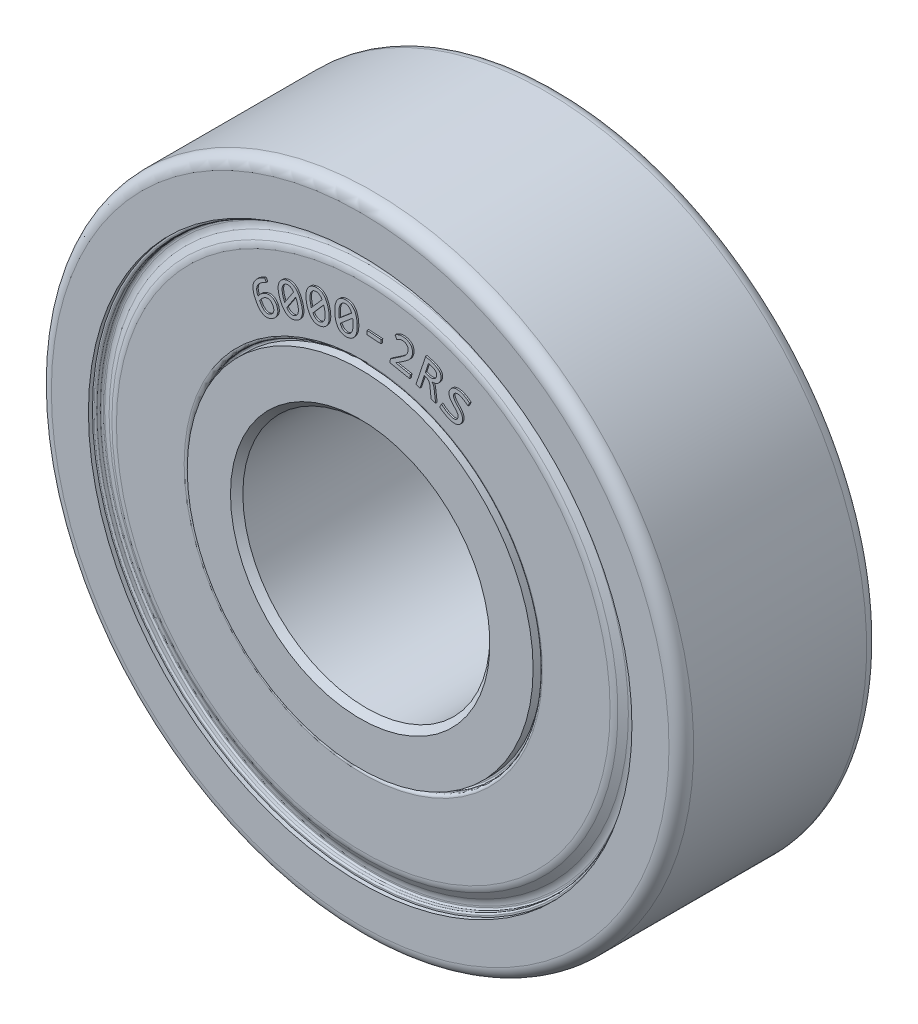
from build123d import *

# Parameters (mm, degrees)
EMBOSS_ON_SEAL_DEPTH = 0.0625


# Read off the part's stored shape, not the designer's step: Emboss_on_Seal
with BuildPart() as part:
    # Shield_RevolverSketch → ShieldsORseals (revolve)
    with BuildSketch(Plane(origin=(0, 0, 0), x_dir=(0, 0, -1), z_dir=(1, 0, 0)), mode=Mode.PRIVATE) as shieldsorseals_sk:
        with BuildLine():
            Line((-0.163675135, 11), (-7.836324865, 11))
            Line((-7.836324865, 11), (-7.836324865, 10.9375))
            ThreePointArc((-7.836324865, 10.9375), (-7.818019039, 10.893305826), (-7.773824865, 10.875))
            Line((-7.773824865, 10.875), (-7.648824865, 10.875))
            ThreePointArc((-7.648824865, 10.875), (-7.604630692, 10.856694174), (-7.586324865, 10.8125))
            Line((-7.586324865, 10.8125), (-7.586324865, 10.758974596))
            ThreePointArc((-7.586324865, 10.758974596), (-7.603361952, 10.629565074), (-7.653312164, 10.508974596))
            Line((-7.653312164, 10.508974596), (-7.808012702, 10.241025404))
            ThreePointArc((-7.808012702, 10.241025404), (-7.857962913, 10.120434926), (-7.875, 9.991025404))
            Line((-7.875, 9.991025404), (-7.875, 7.25))
            ThreePointArc((-7.875, 7.25), (-7.838388348, 7.161611652), (-7.75, 7.125))
            Line((-7.75, 7.125), (-7.6875, 7.125))
            ThreePointArc((-7.6875, 7.125), (-7.643305826, 7.106694174), (-7.625, 7.0625))
            Line((-7.625, 7.0625), (-7.625, 7))
            Line((-7.625, 7), (-0.375, 7))
            Line((-0.375, 7), (-0.375, 7.0625))
            ThreePointArc((-0.375, 7.0625), (-0.356694174, 7.106694174), (-0.3125, 7.125))
            Line((-0.3125, 7.125), (-0.25, 7.125))
            ThreePointArc((-0.25, 7.125), (-0.161611652, 7.161611652), (-0.125, 7.25))
            Line((-0.125, 7.25), (-0.125, 9.991025404))
            ThreePointArc((-0.125, 9.991025404), (-0.142037087, 10.120434926), (-0.191987298, 10.241025404))
            Line((-0.191987298, 10.241025404), (-0.346687836, 10.508974596))
            ThreePointArc((-0.346687836, 10.508974596), (-0.396638048, 10.629565074), (-0.413675135, 10.758974596))
            Line((-0.413675135, 10.758974596), (-0.413675135, 10.8125))
            ThreePointArc((-0.413675135, 10.8125), (-0.395369308, 10.856694174), (-0.351175135, 10.875))
            Line((-0.351175135, 10.875), (-0.226175135, 10.875))
            ThreePointArc((-0.226175135, 10.875), (-0.181980961, 10.893305826), (-0.163675135, 10.9375))
            Line((-0.163675135, 10.9375), (-0.163675135, 11))
        make_face()
    revolve(shieldsorseals_sk.sketch.rotate(Axis((0, 0, 0), (0, 0, 1)), 90), axis=Axis((0, 0, 0), (0, 0, 1)))

    # ProfileRevolveSketch → InnerANDouterRaces (revolve)
    with BuildSketch(Plane(origin=(0, 0, 0), x_dir=(0, 0, -1), z_dir=(1, 0, 0)), mode=Mode.PRIVATE) as innerandouterraces_sk:
        Polygon((0, 5.25), (0, 7), (-8, 7), (-8, 5.25), (-7.75, 5), (-0.25, 5), align=None)
        with BuildLine():
            Line((0, 12.5), (0, 11))
            Line((0, 11), (-8, 11))
            Line((-8, 11), (-8, 12.5))
            ThreePointArc((-8, 12.5), (-7.853553391, 12.853553391), (-7.5, 13))
            Line((-7.5, 13), (-0.5, 13))
            ThreePointArc((-0.5, 13), (-0.146446609, 12.853553391), (0, 12.5))
        make_face()
    revolve(innerandouterraces_sk.sketch.rotate(Axis((0, 0, 0), (0, 0, 1)), 90), axis=Axis((0, 0, 0), (0, 0, 1)))

    # Emboss_on_Seal outline → Emboss_on_Seal (add)
    # profile 1 of 8: a face of its own
    with BuildSketch(Plane.XY.offset(7.875)):
        with BuildLine():
            add(Edge.make_bspline(
                [(3.45441781, 7.031174743), (3.439631155, 7.038499205), (3.410117931, 7.053118366), (3.367389409, 7.077181496), (3.326412953, 7.102155225), (3.286919376, 7.126469494), (3.250409034, 7.151426575), (3.216410734, 7.175621691), (3.185657769, 7.199264957), (3.166590045, 7.215199518), (3.157486198, 7.222807442)],
                knots=[0, 0, 0, 0, 0.139730273, 0.278892739, 0.415112739, 0.546148088, 0.671591735, 0.789564422, 0.899527948, 1, 1, 1, 1], degree=3))
            add(Edge.make_bspline(
                [(4.053376144, 7.135624471), (4.046657939, 7.122921099), (4.033571714, 7.098176514), (4.009952171, 7.064432905), (3.983206117, 7.035289101), (3.953519284, 7.010867978), (3.921668075, 6.990592221), (3.887525726, 6.974704334), (3.851598479, 6.962414407), (3.81355886, 6.954589307), (3.773808663, 6.950547906), (3.732198561, 6.951137488), (3.68882432, 6.955041979), (3.64391045, 6.963141241), (3.597742222, 6.974732626), (3.550677175, 6.990275607), (3.502509524, 7.008824957), (3.470659743, 7.023626588), (3.45441781, 7.031174743)],
                knots=[0, 0, 0, 0, 0.06287168, 0.122466191, 0.179764453, 0.23551097, 0.290289466, 0.34461754, 0.400004764, 0.456149318, 0.51426959, 0.574581344, 0.638047313, 0.704738398, 0.774168554, 0.846277541, 0.921608574, 1, 1, 1, 1], degree=3))
            add(Edge.make_bspline(
                [(3.727572249, 7.959050649), (3.724292969, 7.951593225), (3.717892837, 7.937038655), (3.712829711, 7.914018129), (3.711560722, 7.891130414), (3.714673554, 7.868446791), (3.720815098, 7.845944347), (3.729346393, 7.823335984), (3.74024233, 7.800578015), (3.757973314, 7.769400779), (3.785930024, 7.730602271), (3.824988781, 7.684824444), (3.86808663, 7.638721584), (3.911561338, 7.590736221), (3.954732962, 7.541503565), (3.988901379, 7.498831536), (4.014491031, 7.463791109), (4.031443577, 7.436952363), (4.046322233, 7.409543107), (4.059050075, 7.381566261), (4.069621141, 7.353065058), (4.077402466, 7.323887996), (4.082070806, 7.294093755), (4.084506336, 7.263712823), (4.083609103, 7.232457971), (4.07749422, 7.200617442), (4.068119088, 7.167781176), (4.058386478, 7.146552807), (4.053376144, 7.135624471)],
                knots=[0, 0, 0, 0, 0.025721514, 0.050200386, 0.074112047, 0.097883538, 0.122285839, 0.147791641, 0.174230722, 0.202038248, 0.2611729, 0.325157145, 0.392347997, 0.460823694, 0.530019844, 0.599485921, 0.633702941, 0.667245272, 0.699837623, 0.732301208, 0.764411499, 0.795909548, 0.827662612, 0.859693708, 0.892254599, 0.92621805, 0.962017149, 1, 1, 1, 1], degree=3))
            add(Edge.make_bspline(
                [(4.060169622, 7.997263964), (4.049558478, 8.002282388), (4.029031008, 8.011990631), (3.998422668, 8.024250254), (3.969201897, 8.033682862), (3.941772643, 8.041761178), (3.915567024, 8.046418922), (3.890969618, 8.049201098), (3.867818603, 8.04916663), (3.846161102, 8.047008816), (3.826075986, 8.042418176), (3.807497846, 8.036142557), (3.790201827, 8.028303312), (3.774684028, 8.017922299), (3.760404833, 8.006082171), (3.747811964, 7.992232496), (3.736633436, 7.976572793), (3.730640177, 7.96498328), (3.727572249, 7.959050649)],
                knots=[0, 0, 0, 0, 0.093517572, 0.180911619, 0.262457481, 0.33815508, 0.408492174, 0.47424837, 0.53514468, 0.592597637, 0.647314469, 0.698905037, 0.748683471, 0.798102942, 0.847195376, 0.896149455, 0.946839267, 1, 1, 1, 1], degree=3))
            add(Edge.make_bspline(
                [(4.301621162, 7.832805178), (4.282400356, 7.849305069), (4.244270184, 7.882037501), (4.184043385, 7.92575903), (4.123190368, 7.965053564), (4.080928774, 7.986653798), (4.060169622, 7.997263964)],
                knots=[0, 0, 0, 0, 0.259263493, 0.51432609, 0.761434016, 1, 1, 1, 1], degree=3))
            Line((4.301621162, 7.832805178), (4.367857575, 7.970090051))
            add(Edge.make_bspline(
                [(4.127538281, 8.127472297), (4.137320454, 8.122684407), (4.157734081, 8.112692946), (4.187998581, 8.094857147), (4.219902029, 8.076565685), (4.250999369, 8.055450842), (4.282375821, 8.034703428), (4.312311784, 8.012811583), (4.341076545, 7.991735481), (4.359134891, 7.97714005), (4.367857575, 7.970090051)],
                knots=[0, 0, 0, 0, 0.113470904, 0.236793278, 0.36598711, 0.496639965, 0.628383824, 0.758026039, 0.883119846, 1, 1, 1, 1], degree=3))
            add(Edge.make_bspline(
                [(3.560282846, 8.020758076), (3.565139745, 8.030242597), (3.574848191, 8.049201191), (3.59377793, 8.075174402), (3.614669696, 8.100077541), (3.638688832, 8.122982256), (3.665679826, 8.143336963), (3.695038136, 8.161070006), (3.727334535, 8.17488964), (3.761883036, 8.185995214), (3.799153452, 8.193685261), (3.839114795, 8.197272123), (3.88154859, 8.196754775), (3.926556689, 8.19286849), (3.973965328, 8.184304036), (4.023529382, 8.17049726), (4.075358698, 8.15179474), (4.109730169, 8.135773184), (4.127538281, 8.127472297)],
                knots=[0, 0, 0, 0, 0.049384264, 0.098714132, 0.148731208, 0.200149232, 0.252350135, 0.305373005, 0.358908795, 0.414998657, 0.47357219, 0.535144948, 0.60083463, 0.670297316, 0.744600862, 0.824067626, 0.908848139, 1, 1, 1, 1], degree=3))
            add(Edge.make_bspline(
                [(3.88948348, 7.204408439), (3.892757014, 7.211867057), (3.899108877, 7.226339529), (3.904236162, 7.249151734), (3.905486901, 7.271857938), (3.902377477, 7.294444793), (3.896278412, 7.316867393), (3.887735337, 7.339336202), (3.876586013, 7.361708868), (3.858194645, 7.392209352), (3.830707004, 7.431069188), (3.790946799, 7.476161688), (3.748595036, 7.523002348), (3.704442412, 7.570575311), (3.661834866, 7.620351525), (3.62020582, 7.670380821), (3.583950745, 7.72267122), (3.560043569, 7.768637155), (3.545413966, 7.806207989), (3.537388527, 7.835028042), (3.532486091, 7.864445716), (3.529600438, 7.894453522), (3.530746798, 7.925307779), (3.536287406, 7.956857213), (3.5459172, 7.989109925), (3.555403217, 8.010008038), (3.560282846, 8.020758076)],
                knots=[0, 0, 0, 0, 0.025875241, 0.05020752, 0.073962163, 0.097875727, 0.122423871, 0.147801143, 0.174258853, 0.201864236, 0.261106971, 0.325438586, 0.39305102, 0.462137944, 0.531974653, 0.601575938, 0.669211711, 0.734084274, 0.76592956, 0.79740454, 0.8291008, 0.860748653, 0.893204044, 0.92702293, 0.962460426, 1, 1, 1, 1], degree=3))
            add(Edge.make_bspline(
                [(3.530844441, 7.160533891), (3.542770199, 7.154930348), (3.565735647, 7.144139598), (3.599748029, 7.130689526), (3.631479062, 7.119413495), (3.661344354, 7.11106482), (3.689382968, 7.105638368), (3.715701643, 7.10280839), (3.740268584, 7.101927032), (3.763237895, 7.104346576), (3.784523534, 7.108794317), (3.804338807, 7.115510208), (3.822190059, 7.125039171), (3.838730882, 7.136438845), (3.853351232, 7.150576469), (3.867001686, 7.166424196), (3.879361921, 7.184411277), (3.886049159, 7.19762325), (3.88948348, 7.204408439)],
                knots=[0, 0, 0, 0, 0.096309947, 0.185464196, 0.267273306, 0.342415518, 0.41195339, 0.475790047, 0.535819693, 0.591280026, 0.644180236, 0.694574418, 0.743633703, 0.791668714, 0.840955407, 0.89183355, 0.944449651, 1, 1, 1, 1], degree=3))
            add(Edge.make_bspline(
                [(3.22881772, 7.370282533), (3.237971487, 7.361033592), (3.256668415, 7.342142269), (3.28710094, 7.315046796), (3.319992991, 7.288174843), (3.355466174, 7.26131791), (3.394357656, 7.235323723), (3.436683252, 7.209921968), (3.482321195, 7.184591034), (3.514359317, 7.168706983), (3.530844441, 7.160533891)],
                knots=[0, 0, 0, 0, 0.10557827, 0.215647752, 0.330451754, 0.450204732, 0.576561049, 0.70984495, 0.850701559, 1, 1, 1, 1], degree=3))
            Line((3.22881772, 7.370282533), (3.157486198, 7.222807442))
        make_face()
    # profile 2 of 8: a face of its own
    with BuildSketch(Plane.XY.offset(7.875)):
        with BuildLine():
            add(Edge.make_bspline(
                [(2.759169747, 7.771932374), (2.757240802, 7.787371428), (2.753645028, 7.816151591), (2.743668991, 7.8557549), (2.730921652, 7.889416334), (2.713687453, 7.917321634), (2.693197432, 7.940786911), (2.668117423, 7.959437553), (2.639432742, 7.975246351), (2.618236627, 7.983006157), (2.607165671, 7.987059186)],
                knots=[0, 0, 0, 0, 0.164940583, 0.307468114, 0.432394679, 0.545200928, 0.653695775, 0.760819421, 0.875073435, 1, 1, 1, 1], degree=3))
            Line((2.759169747, 7.771932374), (2.809554711, 7.336300581))
            Line((2.809554711, 7.336300581), (2.990997193, 7.276008461))
            Line((2.990997193, 7.276008461), (2.933252627, 7.726359458))
            add(Edge.make_bspline(
                [(2.836162501, 7.951959548), (2.84314297, 7.946114543), (2.85706355, 7.934458327), (2.874712985, 7.913371196), (2.889593165, 7.88979661), (2.901015482, 7.863142053), (2.910984403, 7.833862471), (2.919655894, 7.801214843), (2.92727167, 7.765021728), (2.931205788, 7.739590696), (2.933252627, 7.726359458)],
                knots=[0, 0, 0, 0, 0.108189091, 0.215752654, 0.32575114, 0.438870128, 0.559980313, 0.69374438, 0.840661551, 1, 1, 1, 1], degree=3))
            add(Edge.make_bspline(
                [(3.19112174, 8.174729023), (3.187866384, 8.16570802), (3.18142856, 8.147867995), (3.169397971, 8.122360427), (3.155867471, 8.098104323), (3.14023101, 8.075616894), (3.123351598, 8.054465805), (3.104365238, 8.035455456), (3.084102153, 8.017805542), (3.061950457, 8.002240963), (3.038334093, 7.988783574), (3.013580002, 7.9764808), (2.98692107, 7.967257017), (2.959135485, 7.959079876), (2.9300456, 7.953486952), (2.899743554, 7.950362808), (2.868307154, 7.949825954), (2.847007296, 7.951239727), (2.836162501, 7.951959548)],
                knots=[0, 0, 0, 0, 0.063202166, 0.124989237, 0.185718043, 0.24611454, 0.305382274, 0.363890912, 0.423001714, 0.482377098, 0.542025622, 0.602126624, 0.664313292, 0.727720268, 0.792994987, 0.859293363, 0.9283594, 1, 1, 1, 1], degree=3))
            add(Edge.make_bspline(
                [(2.904663406, 8.61460674), (2.921172295, 8.608899176), (2.952980316, 8.597902293), (2.997639703, 8.578128564), (3.03796145, 8.557187824), (3.073484656, 8.534063934), (3.104823766, 8.509932568), (3.132325598, 8.484807756), (3.155262662, 8.458031986), (3.174529085, 8.430436778), (3.189708005, 8.401638988), (3.200761872, 8.371632314), (3.208300336, 8.340578789), (3.211461085, 8.308511006), (3.211532205, 8.275783614), (3.207888121, 8.242462896), (3.201622199, 8.208459883), (3.194657221, 8.18608613), (3.19112174, 8.174729023)],
                knots=[0, 0, 0, 0, 0.087682314, 0.168939342, 0.245029882, 0.315605213, 0.381473015, 0.443500021, 0.502293813, 0.558152352, 0.612196922, 0.665268996, 0.718364331, 0.772207052, 0.826696356, 0.882424118, 0.940317481, 1, 1, 1, 1], degree=3))
            Line((2.904663406, 8.61460674), (2.588766667, 8.719905653))
            Line((2.588766667, 8.719905653), (2.196160236, 7.540671052))
            Line((2.196160236, 7.540671052), (2.35665616, 7.487172411))
            Line((2.35665616, 7.487172411), (2.531305164, 8.012251668))
            Line((2.531305164, 8.012251668), (2.607165671, 7.987059186))
        make_face()
        with BuildLine():
            add(Edge.make_bspline(
                [(2.704255798, 8.098019331), (2.713556816, 8.095045414), (2.731713153, 8.089240089), (2.758919226, 8.083149371), (2.785183184, 8.078775835), (2.810540462, 8.076433842), (2.835084791, 8.076386233), (2.858398262, 8.07863363), (2.880603481, 8.082897205), (2.90156843, 8.089287423), (2.92112142, 8.098321047), (2.93978833, 8.108623166), (2.95675551, 8.121656441), (2.972825833, 8.136251227), (2.986850495, 8.153521135), (2.999873084, 8.172391243), (3.010180097, 8.193947466), (3.015836602, 8.209123174), (3.018737229, 8.216905201)],
                knots=[0, 0, 0, 0, 0.077017221, 0.150343817, 0.219743991, 0.287014878, 0.351043494, 0.413124933, 0.471530521, 0.529224723, 0.585543029, 0.641227858, 0.697066767, 0.753962813, 0.812111589, 0.87220122, 0.934465428, 1, 1, 1, 1], degree=3))
            Line((2.704255798, 8.098019331), (2.574330526, 8.141327755))
            Line((2.574330526, 8.141327755), (2.703972736, 8.53110357))
            Line((2.703972736, 8.53110357), (2.855693751, 8.480718606))
            add(Edge.make_bspline(
                [(3.018737229, 8.216905201), (3.021166838, 8.224598928), (3.025883062, 8.239533566), (3.030044172, 8.262055381), (3.032101445, 8.283562989), (3.031939752, 8.304281788), (3.029088641, 8.324059526), (3.023883412, 8.343044854), (3.016593773, 8.361165941), (3.006803059, 8.378333627), (2.994809334, 8.394471601), (2.980850125, 8.409806793), (2.96497891, 8.424274384), (2.947044416, 8.437616679), (2.926933628, 8.449784669), (2.905046642, 8.461313733), (2.881144587, 8.471896952), (2.864326323, 8.477726423), (2.855693751, 8.480718606)],
                knots=[0, 0, 0, 0, 0.068446959, 0.132865454, 0.194007603, 0.251693162, 0.308340268, 0.363144697, 0.41848518, 0.473732809, 0.530453509, 0.588868735, 0.649547279, 0.712514812, 0.778327926, 0.848921222, 0.922453443, 1, 1, 1, 1], degree=3))
        make_face(mode=Mode.SUBTRACT)
    # profile 3 of 8: a face of its own
    with BuildSketch(Plane.XY.offset(7.875)):
        with BuildLine():
            add(Edge.make_bspline(
                [(1.540922421, 8.170595752), (1.555779835, 8.180438271), (1.58425403, 8.199301434), (1.624371568, 8.227357523), (1.660486279, 8.253410185), (1.692612134, 8.277809772), (1.721323554, 8.300909548), (1.746728147, 8.323293918), (1.76954668, 8.344675201), (1.789249181, 8.365813468), (1.806236117, 8.386445735), (1.820910431, 8.406706213), (1.833107787, 8.426787815), (1.846492521, 8.453689075), (1.859765508, 8.489292127), (1.866420388, 8.519042629), (1.869839993, 8.534329901)],
                knots=[0, 0, 0, 0, 0.105706182, 0.202585624, 0.290352419, 0.369826149, 0.441848578, 0.508870087, 0.570625752, 0.627251094, 0.680135288, 0.729059969, 0.775515144, 0.819315489, 0.907155413, 1, 1, 1, 1], degree=3))
            Line((1.540922421, 8.170595752), (1.161902946, 7.917538687))
            Line((1.161902946, 7.917538687), (1.133313725, 7.771195843))
            Line((1.133313725, 7.771195843), (1.940605392, 7.612964411))
            Line((1.940605392, 7.612964411), (1.971176044, 7.768648288))
            Line((1.971176044, 7.768648288), (1.375897511, 7.885552727))
            Line((1.375897511, 7.885552727), (1.640560102, 8.058503361))
            add(Edge.make_bspline(
                [(2.048451859, 8.51111885), (2.045963558, 8.499664694), (2.041066882, 8.477124296), (2.031207887, 8.44450321), (2.018854275, 8.413744837), (2.004656123, 8.384375935), (1.988171971, 8.356109546), (1.968809803, 8.328910746), (1.94786133, 8.301639772), (1.923772623, 8.275389315), (1.897632212, 8.249207151), (1.868873704, 8.223091151), (1.837530441, 8.196954349), (1.803703356, 8.170432448), (1.766878501, 8.143941835), (1.727606065, 8.116046181), (1.685070353, 8.087598507), (1.655674387, 8.06838316), (1.640560102, 8.058503361)],
                knots=[0, 0, 0, 0, 0.055981022, 0.110163911, 0.162560634, 0.214168157, 0.265885793, 0.318653443, 0.373564502, 0.430051332, 0.488696342, 0.550276703, 0.615548783, 0.683624289, 0.75556958, 0.832228893, 0.913738491, 1, 1, 1, 1], degree=3))
            add(Edge.make_bspline(
                [(1.75208637, 8.940240227), (1.765361814, 8.937374064), (1.791362626, 8.931760498), (1.828570658, 8.919287353), (1.863583607, 8.904776314), (1.895851083, 8.887055624), (1.925709287, 8.867316123), (1.952761236, 8.845136364), (1.976948818, 8.820662696), (1.99835372, 8.79399544), (2.016356301, 8.765012035), (2.031746629, 8.734149635), (2.043081158, 8.70095435), (2.051657333, 8.666021044), (2.056853321, 8.629419142), (2.0577673, 8.591194324), (2.055334881, 8.551474206), (2.050779908, 8.524768266), (2.048451859, 8.51111885)],
                knots=[0, 0, 0, 0, 0.069223284, 0.135578262, 0.199846242, 0.262299269, 0.323031911, 0.382188116, 0.440381148, 0.498254897, 0.556206633, 0.614104389, 0.673769353, 0.734699982, 0.797384369, 0.861902333, 0.929418228, 1, 1, 1, 1], degree=3))
            add(Edge.make_bspline(
                [(1.350138906, 8.851358886), (1.364220239, 8.860875078), (1.392368122, 8.879897473), (1.437377229, 8.903480437), (1.484305499, 8.922888103), (1.533057701, 8.938344116), (1.584337891, 8.948932913), (1.638255889, 8.952146847), (1.69468928, 8.950231134), (1.732608234, 8.943630717), (1.75208637, 8.940240227)],
                knots=[0, 0, 0, 0, 0.120158552, 0.240190966, 0.358697358, 0.479031913, 0.601560619, 0.728015444, 0.860287488, 1, 1, 1, 1], degree=3))
            Line((1.350138906, 8.851358886), (1.418922874, 8.7259626))
            add(Edge.make_bspline(
                [(1.70226753, 8.800124737), (1.689466759, 8.802142031), (1.66425441, 8.806115285), (1.626394294, 8.806502569), (1.589367673, 8.802677221), (1.553472542, 8.793649629), (1.518589648, 8.780978688), (1.484383388, 8.765641323), (1.451033979, 8.747253155), (1.429679891, 8.733094801), (1.418922874, 8.7259626)],
                knots=[0, 0, 0, 0, 0.128888135, 0.253857587, 0.375766508, 0.498587941, 0.621319507, 0.744950374, 0.871519995, 1, 1, 1, 1], degree=3))
            add(Edge.make_bspline(
                [(1.869839993, 8.534329901), (1.872173191, 8.549099906), (1.876777086, 8.578244274), (1.876022623, 8.615094878), (1.871845798, 8.6434696), (1.867161883, 8.663914985), (1.860251777, 8.683341444), (1.851517664, 8.701802774), (1.840637486, 8.719130805), (1.827927932, 8.735563276), (1.812364992, 8.750112517), (1.795161878, 8.763913331), (1.775409223, 8.775748387), (1.753392155, 8.786124246), (1.728710377, 8.794173478), (1.71126714, 8.798099274), (1.70226753, 8.800124737)],
                knots=[0, 0, 0, 0, 0.125758755, 0.248148814, 0.308380614, 0.367164157, 0.424462848, 0.481684355, 0.538789889, 0.596494843, 0.656062592, 0.717739353, 0.781924315, 0.849464456, 0.922333157, 1, 1, 1, 1], degree=3))
        make_face()
    # profile 4 of 8: a face of its own
    with BuildSketch(Plane.XY.offset(7.875)):
        with BuildLine():
            add(Edge.make_bspline(
                [(-0.604750759, 7.796404539), (-0.621169788, 7.79577765), (-0.653306222, 7.794550661), (-0.700812561, 7.798580321), (-0.746194262, 7.807803242), (-0.789840332, 7.821099847), (-0.830847458, 7.840364047), (-0.869462474, 7.864569135), (-0.905213463, 7.894359551), (-0.938655737, 7.929132453), (-0.968921322, 7.969601539), (-0.996133209, 8.015611616), (-1.02045218, 8.067065441), (-1.041629942, 8.124169037), (-1.059368445, 8.187036647), (-1.073695682, 8.255693519), (-1.084463668, 8.330195497), (-1.088433314, 8.381933454), (-1.090484454, 8.408666767)],
                knots=[0, 0, 0, 0, 0.055741177, 0.109100398, 0.161363959, 0.212725579, 0.263597476, 0.31469575, 0.367026011, 0.421168755, 0.478118948, 0.538159501, 0.602345894, 0.671062857, 0.744670079, 0.823886247, 0.909000967, 1, 1, 1, 1], degree=3))
            add(Edge.make_bspline(
                [(-0.182988983, 8.467543578), (-0.181756567, 8.444150681), (-0.179347188, 8.398417445), (-0.180675555, 8.331019912), (-0.185351515, 8.266554534), (-0.193701705, 8.205042808), (-0.20600642, 8.1470795), (-0.222375922, 8.09281757), (-0.243132579, 8.042668769), (-0.267363035, 7.996212799), (-0.295764684, 7.954159656), (-0.327906475, 7.916392689), (-0.364158465, 7.883332715), (-0.404257574, 7.854817511), (-0.448426147, 7.831362211), (-0.496861215, 7.81390629), (-0.549286475, 7.801441365), (-0.585906231, 7.798115849), (-0.604750759, 7.796404539)],
                knots=[0, 0, 0, 0, 0.078571948, 0.153608567, 0.225985767, 0.295333763, 0.361707588, 0.424594984, 0.485205426, 0.543547098, 0.600090982, 0.655097759, 0.70954788, 0.764269712, 0.81978065, 0.876766768, 0.936584175, 1, 1, 1, 1], degree=3))
            add(Edge.make_bspline(
                [(-0.668439617, 9.080654992), (-0.652019357, 9.081285217), (-0.619880515, 9.082518736), (-0.572391533, 9.07844202), (-0.526918126, 9.069386178), (-0.483434298, 9.055432087), (-0.44193633, 9.036925581), (-0.403575585, 9.012097915), (-0.367472639, 8.982454158), (-0.334458675, 8.947066575), (-0.303877098, 8.906594151), (-0.276831278, 8.860413654), (-0.252727038, 8.80885397), (-0.231906895, 8.751700364), (-0.214124717, 8.688984009), (-0.199746664, 8.620428149), (-0.189014751, 8.546014078), (-0.185041821, 8.494276629), (-0.182988983, 8.467543578)],
                knots=[0, 0, 0, 0, 0.055707574, 0.109034629, 0.161266683, 0.21269407, 0.263692267, 0.314931013, 0.367229728, 0.421803707, 0.478719568, 0.538999093, 0.603010068, 0.671574354, 0.745137203, 0.823992414, 0.909055824, 1, 1, 1, 1], degree=3))
            add(Edge.make_bspline(
                [(-1.090484454, 8.408666767), (-1.091586445, 8.432060006), (-1.093745444, 8.477891608), (-1.09264109, 8.545298886), (-1.0874901, 8.609847022), (-1.078964043, 8.671468376), (-1.066221335, 8.729739296), (-1.050041586, 8.784317312), (-1.029475222, 8.834649119), (-1.005589331, 8.881208803), (-0.977099169, 8.92314351), (-0.945100173, 8.961067939), (-0.908369491, 8.993607909), (-0.868400866, 9.022292625), (-0.824056243, 9.045666201), (-0.77574538, 9.063504645), (-0.723384346, 9.075489773), (-0.68708609, 9.078902083), (-0.668439617, 9.080654992)],
                knots=[0, 0, 0, 0, 0.078520134, 0.153835197, 0.225884619, 0.295554851, 0.362271338, 0.425732465, 0.486192349, 0.544357567, 0.600872879, 0.65585186, 0.710296538, 0.764990718, 0.820473606, 0.877837259, 0.937244803, 1, 1, 1, 1], degree=3))
        make_face()
        with BuildLine():
            add(Edge.make_bspline(
                [(-0.869413349, 8.150514593), (-0.863200611, 8.134814808), (-0.851035421, 8.104072988), (-0.828232502, 8.061316663), (-0.801667387, 8.023429509), (-0.770684001, 7.991482759), (-0.735197629, 7.966643399), (-0.702611454, 7.951647893), (-0.674758886, 7.943641521), (-0.652326729, 7.940164422), (-0.628740087, 7.938280493), (-0.612678203, 7.938988649), (-0.604467697, 7.939350644)],
                knots=[0, 0, 0, 0, 0.138000298, 0.270218995, 0.39525855, 0.515298467, 0.632179512, 0.74750934, 0.806863456, 0.868640777, 0.932851853, 1, 1, 1, 1], degree=3))
            Line((-0.869413349, 8.150514593), (-0.366412896, 8.577371477))
            add(Edge.make_bspline(
                [(-0.350561447, 8.450842944), (-0.351404949, 8.461609869), (-0.353087724, 8.483089732), (-0.357389024, 8.515012323), (-0.361361305, 8.546485367), (-0.364747667, 8.567190038), (-0.366412896, 8.577371477)],
                knots=[0, 0, 0, 0, 0.253949756, 0.506626183, 0.757385403, 1, 1, 1, 1], degree=3))
            add(Edge.make_bspline(
                [(-0.604467697, 7.939350644), (-0.593850488, 7.940370141), (-0.572920449, 7.942379908), (-0.542767334, 7.950564555), (-0.514344051, 7.962221128), (-0.487788048, 7.977899413), (-0.463494294, 7.997711149), (-0.440749614, 8.020664173), (-0.421145725, 8.047983676), (-0.403150598, 8.078403179), (-0.387538421, 8.112628212), (-0.374741177, 8.150521157), (-0.36426149, 8.191990863), (-0.356160618, 8.236911154), (-0.350468528, 8.285496613), (-0.347893208, 8.337581652), (-0.347450332, 8.393132309), (-0.349503762, 8.43122308), (-0.350561447, 8.450842944)],
                knots=[0, 0, 0, 0, 0.050190388, 0.098941899, 0.146589892, 0.194634614, 0.243663164, 0.293975531, 0.346448235, 0.401662317, 0.460360173, 0.523358812, 0.589901704, 0.661770283, 0.738326817, 0.820266467, 0.907422522, 1, 1, 1, 1], degree=3))
        make_face(mode=Mode.SUBTRACT)
        with BuildLine():
            add(Edge.make_bspline(
                [(-0.408306012, 8.733904539), (-0.414354016, 8.749267638), (-0.42611943, 8.779154068), (-0.449445285, 8.820018583), (-0.475429149, 8.856594697), (-0.506364576, 8.886804745), (-0.541020108, 8.911301947), (-0.573449823, 8.925283357), (-0.600790347, 8.933364537), (-0.622649598, 8.936923322), (-0.645488377, 8.938770767), (-0.661078505, 8.938066825), (-0.669005741, 8.937708886)],
                knots=[0, 0, 0, 0, 0.138379714, 0.2691954, 0.3938291, 0.513646558, 0.630274392, 0.747969712, 0.808113429, 0.869162392, 0.933471962, 1, 1, 1, 1], degree=3))
            Line((-0.408306012, 8.733904539), (-0.911023404, 8.309029086))
            add(Edge.make_bspline(
                [(-0.922628929, 8.425367401), (-0.921978073, 8.415553881), (-0.920669687, 8.395826195), (-0.918540195, 8.366359162), (-0.915591627, 8.337337252), (-0.912528826, 8.31835782), (-0.911023404, 8.309029086)],
                knots=[0, 0, 0, 0, 0.252229846, 0.507046496, 0.757704438, 1, 1, 1, 1], degree=3))
            add(Edge.make_bspline(
                [(-0.669005741, 8.937708886), (-0.679524853, 8.936675311), (-0.700352127, 8.934628889), (-0.730489865, 8.926568448), (-0.758797857, 8.91450727), (-0.785283168, 8.898843052), (-0.809908715, 8.879475672), (-0.832002072, 8.855898669), (-0.852181097, 8.828873243), (-0.870066, 8.798121869), (-0.885194673, 8.763658067), (-0.898225495, 8.725784762), (-0.908963632, 8.68434457), (-0.917013485, 8.639295675), (-0.922726663, 8.590714772), (-0.925295757, 8.538628388), (-0.925740433, 8.483078121), (-0.923686746, 8.444987294), (-0.922628929, 8.425367401)],
                knots=[0, 0, 0, 0, 0.049726452, 0.098455685, 0.146253734, 0.194276502, 0.243005736, 0.293306896, 0.346020493, 0.401592811, 0.460485651, 0.523035285, 0.590089097, 0.661924836, 0.738446388, 0.820348596, 0.907464825, 1, 1, 1, 1], degree=3))
        make_face(mode=Mode.SUBTRACT)
    # profile 5 of 8: a face of its own
    with BuildSketch(Plane.XY.offset(7.875)):
        with BuildLine():
            add(Edge.make_bspline(
                [(-1.660323182, 7.647717326), (-1.676506381, 7.644762029), (-1.708231794, 7.638968489), (-1.755984862, 7.635740199), (-1.802465119, 7.638181528), (-1.84780483, 7.644937128), (-1.891399085, 7.657949904), (-1.933357358, 7.676065428), (-1.973255617, 7.700257767), (-2.011454614, 7.729777917), (-2.047094263, 7.765639468), (-2.081068216, 7.806906538), (-2.112277103, 7.854576541), (-2.141847823, 7.907921639), (-2.168682404, 7.967706993), (-2.19274745, 8.033717284), (-2.214806667, 8.105844884), (-2.226392002, 8.156483861), (-2.232390663, 8.182703739)],
                knots=[0, 0, 0, 0, 0.055690295, 0.1091748, 0.161647253, 0.213083776, 0.264049566, 0.315286157, 0.367461933, 0.421669068, 0.478388725, 0.538334195, 0.60241655, 0.671076633, 0.744734798, 0.824105681, 0.908925338, 1, 1, 1, 1], degree=3))
            add(Edge.make_bspline(
                [(-1.341878888, 8.375185623), (-1.337140136, 8.352215748), (-1.327862073, 8.307242741), (-1.319364931, 8.240248057), (-1.314298588, 8.175627312), (-1.313696649, 8.113487139), (-1.317225428, 8.054145105), (-1.325221959, 7.997903647), (-1.338382085, 7.945078602), (-1.355501291, 7.895558466), (-1.377312464, 7.849713414), (-1.403867229, 7.807743572), (-1.434865585, 7.769564665), (-1.47040621, 7.73539418), (-1.51070962, 7.705553555), (-1.556148682, 7.681037402), (-1.606244998, 7.660864073), (-1.641976698, 7.652177472), (-1.660323182, 7.647717326)],
                knots=[0, 0, 0, 0, 0.078514714, 0.153724949, 0.2259668, 0.295483762, 0.361649773, 0.424879937, 0.485421576, 0.543681573, 0.600071934, 0.655034913, 0.709614184, 0.764365135, 0.819725395, 0.876994164, 0.936842511, 1, 1, 1, 1], degree=3))
            add(Edge.make_bspline(
                [(-1.91394637, 8.911021221), (-1.89776697, 8.914098342), (-1.866063568, 8.920127934), (-1.818380733, 8.923235515), (-1.771961605, 8.92093765), (-1.726695581, 8.913662389), (-1.682949821, 8.900862367), (-1.640842645, 8.882692487), (-1.600989285, 8.858195088), (-1.562902576, 8.828288197), (-1.526783085, 8.792631171), (-1.492941494, 8.750944867), (-1.46178139, 8.703081905), (-1.432117451, 8.649693428), (-1.405393074, 8.589961719), (-1.381097487, 8.524153363), (-1.359563636, 8.451984989), (-1.347914003, 8.401394255), (-1.341878888, 8.375185623)],
                knots=[0, 0, 0, 0, 0.055697912, 0.1091396, 0.161251111, 0.212697022, 0.263928434, 0.315124009, 0.367423021, 0.421783128, 0.478684513, 0.538829171, 0.603126402, 0.671731521, 0.74533072, 0.824338577, 0.908998246, 1, 1, 1, 1], degree=3))
            add(Edge.make_bspline(
                [(-2.232390663, 8.182703739), (-2.237015884, 8.20567791), (-2.246093472, 8.250767664), (-2.254592406, 8.317829853), (-2.259776094, 8.38254373), (-2.259977589, 8.444788166), (-2.256243537, 8.504329717), (-2.247799802, 8.560681134), (-2.23506009, 8.613645673), (-2.218199639, 8.663306029), (-2.19640257, 8.709152916), (-2.170159697, 8.751365148), (-2.139092874, 8.789431778), (-2.103565641, 8.823733441), (-2.063014144, 8.853362044), (-2.017697045, 8.877999693), (-1.967680581, 8.897801768), (-1.932188077, 8.906533477), (-1.91394637, 8.911021221)],
                knots=[0, 0, 0, 0, 0.0784223, 0.153913809, 0.226125033, 0.295610369, 0.362083823, 0.425646015, 0.486086939, 0.544218509, 0.600870056, 0.655641522, 0.710197654, 0.764925392, 0.820516676, 0.877761164, 0.937174198, 1, 1, 1, 1], degree=3))
        make_face()
        with BuildLine():
            add(Edge.make_bspline(
                [(-1.975087674, 7.959651203), (-1.966699115, 7.944938374), (-1.950323532, 7.916216978), (-1.921413653, 7.87715459), (-1.889277902, 7.843824678), (-1.853815491, 7.81691197), (-1.815093355, 7.797382846), (-1.780489458, 7.787258423), (-1.751559758, 7.783354746), (-1.728798552, 7.783365016), (-1.705158728, 7.784793952), (-1.689358807, 7.787927107), (-1.68126974, 7.789531185)],
                knots=[0, 0, 0, 0, 0.138114821, 0.269618472, 0.395389575, 0.514727632, 0.631108304, 0.747336073, 0.807117999, 0.868716647, 0.932787005, 1, 1, 1, 1], degree=3))
            Line((-1.975087674, 7.959651203), (-1.540022004, 8.457273486))
            add(Edge.make_bspline(
                [(-1.50548849, 8.333858631), (-1.507962812, 8.34444486), (-1.51288588, 8.365507883), (-1.521549459, 8.396679044), (-1.530455472, 8.427271916), (-1.536866952, 8.447378939), (-1.540022004, 8.457273486)],
                knots=[0, 0, 0, 0, 0.254385274, 0.506140848, 0.756974859, 1, 1, 1, 1], degree=3))
            add(Edge.make_bspline(
                [(-1.68126974, 7.789531185), (-1.671000077, 7.792204347), (-1.65069734, 7.797489088), (-1.621933807, 7.809720196), (-1.595638743, 7.825792436), (-1.571721018, 7.84526013), (-1.54988484, 7.867881947), (-1.531760541, 7.894594767), (-1.515532571, 7.924018588), (-1.502743967, 7.957009428), (-1.492519682, 7.99321297), (-1.485325062, 8.032642442), (-1.480755295, 8.075310367), (-1.479609975, 8.121186007), (-1.480883468, 8.17016405), (-1.486001772, 8.222108241), (-1.493779175, 8.277131707), (-1.501503628, 8.314553578), (-1.50548849, 8.333858631)],
                knots=[0, 0, 0, 0, 0.049897755, 0.098645983, 0.146475314, 0.194469291, 0.243471722, 0.293859136, 0.345923154, 0.401339452, 0.459960247, 0.522758525, 0.589749034, 0.66172493, 0.738583575, 0.820200885, 0.907245918, 1, 1, 1, 1], degree=3))
        make_face(mode=Mode.SUBTRACT)
        with BuildLine():
            add(Edge.make_bspline(
                [(-1.604276986, 8.606163884), (-1.612656766, 8.620420782), (-1.628952168, 8.648144884), (-1.65778557, 8.685417794), (-1.689056689, 8.717724448), (-1.724223136, 8.743157316), (-1.762356977, 8.761946711), (-1.796396405, 8.771440049), (-1.824685596, 8.775278159), (-1.846902068, 8.775868441), (-1.869829844, 8.773768606), (-1.885187684, 8.770932882), (-1.892999812, 8.769490424)],
                knots=[0, 0, 0, 0, 0.138351043, 0.26903879, 0.393620758, 0.513569699, 0.630525504, 0.747841005, 0.807620012, 0.869265072, 0.933498586, 1, 1, 1, 1], degree=3))
            Line((-1.604276986, 8.606163884), (-2.040191841, 8.110523033))
            add(Edge.make_bspline(
                [(-2.068498, 8.224030732), (-2.066315716, 8.21431516), (-2.061971322, 8.19497384), (-2.055705808, 8.166069578), (-2.048357123, 8.137954215), (-2.042883769, 8.119566536), (-2.040191841, 8.110523033)],
                knots=[0, 0, 0, 0, 0.255275749, 0.508191355, 0.758116662, 1, 1, 1, 1], degree=3))
            add(Edge.make_bspline(
                [(-1.892999812, 8.769490424), (-1.903275652, 8.766934191), (-1.923614942, 8.761874559), (-1.952333112, 8.749568296), (-1.978736629, 8.733440679), (-2.002733671, 8.713935463), (-2.024362384, 8.691034723), (-2.042603514, 8.664389762), (-2.058717822, 8.634699836), (-2.071540365, 8.601445765), (-2.0816769, 8.565039325), (-2.089098566, 8.525460193), (-2.092981344, 8.482644194), (-2.094909004, 8.436802188), (-2.092923305, 8.387825724), (-2.088052719, 8.335873024), (-2.080192191, 8.280757978), (-2.072477715, 8.243335894), (-2.068498, 8.224030732)],
                knots=[0, 0, 0, 0, 0.049684951, 0.09834297, 0.146083792, 0.194612423, 0.243219941, 0.293514112, 0.34587164, 0.401597676, 0.460536577, 0.523218646, 0.590480704, 0.662338449, 0.738625957, 0.820533605, 0.90741756, 1, 1, 1, 1], degree=3))
        make_face(mode=Mode.SUBTRACT)
    # profile 6 of 8: a face of its own
    with BuildSketch(Plane.XY.offset(7.875)):
        with BuildLine():
            add(Edge.make_bspline(
                [(-2.683269103, 7.352005497), (-2.698739172, 7.346832673), (-2.729001055, 7.33671382), (-2.775508621, 7.327858021), (-2.82130468, 7.323320521), (-2.866720837, 7.324559606), (-2.911338086, 7.330791648), (-2.954816451, 7.343776961), (-2.997512681, 7.361426205), (-3.038789867, 7.385682433), (-3.079070281, 7.415531461), (-3.117320254, 7.452243666), (-3.155055238, 7.494287166), (-3.190769927, 7.543031113), (-3.225575816, 7.597780245), (-3.257664854, 7.659533113), (-3.289216796, 7.72723632), (-3.307364988, 7.775425706), (-3.316760951, 7.800375062)],
                knots=[0, 0, 0, 0, 0.055708524, 0.10897461, 0.1614545, 0.212759378, 0.263943441, 0.314987043, 0.367466932, 0.421521255, 0.478229414, 0.538473217, 0.60244303, 0.671151224, 0.744802539, 0.824022242, 0.908890069, 1, 1, 1, 1], degree=3))
            add(Edge.make_bspline(
                [(-2.468142291, 8.109478323), (-2.460535824, 8.087572649), (-2.445606623, 8.044578415), (-2.427872422, 7.980103849), (-2.41433571, 7.917278649), (-2.405598258, 7.856364877), (-2.401120442, 7.79762406), (-2.401633001, 7.741370225), (-2.40683227, 7.687588868), (-2.417333484, 7.636565264), (-2.432469069, 7.58840208), (-2.453077622, 7.543613884), (-2.478463147, 7.502031936), (-2.508455298, 7.463434251), (-2.544270576, 7.428966906), (-2.585366128, 7.39857367), (-2.631897409, 7.372156621), (-2.665812, 7.358853242), (-2.683269103, 7.352005497)],
                knots=[0, 0, 0, 0, 0.078312891, 0.153704597, 0.225717406, 0.295266728, 0.361415149, 0.424525301, 0.485067359, 0.543636787, 0.600183654, 0.655234037, 0.70973175, 0.764437834, 0.819886282, 0.877065556, 0.936721063, 1, 1, 1, 1], degree=3))
            add(Edge.make_bspline(
                [(-3.101917201, 8.558697073), (-3.086439765, 8.563827559), (-3.056145845, 8.573869438), (-3.009823707, 8.583302672), (-2.964053323, 8.587254365), (-2.918736698, 8.586219938), (-2.874122796, 8.579717858), (-2.830326943, 8.567554021), (-2.787972515, 8.548775796), (-2.746587073, 8.524444754), (-2.706324964, 8.494280639), (-2.667375759, 8.458010303), (-2.62998813, 8.415532238), (-2.594072876, 8.366865465), (-2.559495791, 8.31202592), (-2.526668516, 8.250651992), (-2.495868698, 8.182581683), (-2.477594789, 8.13440075), (-2.468142291, 8.109478323)],
                knots=[0, 0, 0, 0, 0.055664587, 0.108952061, 0.161040714, 0.212305127, 0.263448822, 0.314673704, 0.367069591, 0.421243567, 0.478358057, 0.538569877, 0.602730138, 0.671384142, 0.744977368, 0.824001925, 0.908961927, 1, 1, 1, 1], degree=3))
            add(Edge.make_bspline(
                [(-3.316760951, 7.800375062), (-3.324351041, 7.822379917), (-3.339190346, 7.865401378), (-3.357125654, 7.929913926), (-3.370529291, 7.992773614), (-3.379321548, 8.053955288), (-3.383873176, 8.112987955), (-3.382916583, 8.16952041), (-3.377771547, 8.223279397), (-3.36751638, 8.274199076), (-3.352788353, 8.322359584), (-3.332054204, 8.367052881), (-3.306866747, 8.408767328), (-3.276216516, 8.44688793), (-3.240753814, 8.481881937), (-3.19930348, 8.511933345), (-3.153039538, 8.538578275), (-3.119289616, 8.551860294), (-3.101917201, 8.558697073)],
                knots=[0, 0, 0, 0, 0.078564232, 0.153600103, 0.22587781, 0.295382047, 0.362122969, 0.425514711, 0.486017524, 0.54417339, 0.600587472, 0.655602169, 0.710064556, 0.764683193, 0.820317701, 0.877715886, 0.937055547, 1, 1, 1, 1], degree=3))
        make_face()
        with BuildLine():
            add(Edge.make_bspline(
                [(-3.03426548, 7.616101964), (-3.024024297, 7.602892289), (-3.003927965, 7.576970868), (-2.970544691, 7.542177015), (-2.934152006, 7.514086894), (-2.895912469, 7.492078289), (-2.855107534, 7.478508462), (-2.819797118, 7.473083283), (-2.790855308, 7.473017199), (-2.768450811, 7.475617503), (-2.745547723, 7.480841164), (-2.730407661, 7.485858584), (-2.722614664, 7.488441185)],
                knots=[0, 0, 0, 0, 0.137510478, 0.26983759, 0.395480918, 0.51471331, 0.631097865, 0.747275035, 0.807061637, 0.868797907, 0.932466756, 1, 1, 1, 1], degree=3))
            Line((-3.03426548, 7.616101964), (-2.67392807, 8.162976964))
            add(Edge.make_bspline(
                [(-2.623260045, 8.046638649), (-2.627031252, 8.056679845), (-2.634562555, 8.076732654), (-2.647544759, 8.105962227), (-2.660394665, 8.134820276), (-2.669448311, 8.153656679), (-2.67392807, 8.162976964)],
                knots=[0, 0, 0, 0, 0.253432823, 0.506118983, 0.755626823, 1, 1, 1, 1], degree=3))
            add(Edge.make_bspline(
                [(-2.722614664, 7.488441185), (-2.712770173, 7.492423868), (-2.693417715, 7.500253088), (-2.66688959, 7.516386942), (-2.64315403, 7.535483453), (-2.622200901, 7.557823124), (-2.604530642, 7.583390569), (-2.58946959, 7.611696619), (-2.578490133, 7.643089738), (-2.569729275, 7.6770399), (-2.564942941, 7.713994008), (-2.5629113, 7.753656812), (-2.564573954, 7.796041679), (-2.569121955, 7.841144051), (-2.57708761, 7.888999559), (-2.588852732, 7.939434375), (-2.604120898, 7.992456241), (-2.616749421, 8.028207248), (-2.623260045, 8.046638649)],
                knots=[0, 0, 0, 0, 0.050359876, 0.098998245, 0.146789362, 0.194653927, 0.243874862, 0.293976977, 0.346418404, 0.40140301, 0.460203537, 0.523007123, 0.589802264, 0.661399977, 0.738150487, 0.819989386, 0.907195686, 1, 1, 1, 1], degree=3))
        make_face(mode=Mode.SUBTRACT)
        with BuildLine():
            add(Edge.make_bspline(
                [(-2.75743124, 8.300544899), (-2.767521693, 8.313532427), (-2.787118181, 8.338755273), (-2.820496772, 8.371456779), (-2.855682503, 8.398613208), (-2.893420295, 8.418914412), (-2.933194153, 8.432742424), (-2.968002296, 8.437147067), (-2.996291669, 8.436694437), (-3.018141276, 8.434559073), (-3.040401979, 8.429614619), (-3.055062773, 8.424751925), (-3.062571639, 8.422261384)],
                knots=[0, 0, 0, 0, 0.138900276, 0.269755729, 0.393868947, 0.51342069, 0.630458105, 0.747894386, 0.807722122, 0.869470399, 0.933146236, 1, 1, 1, 1], degree=3))
            Line((-2.75743124, 8.300544899), (-3.118334773, 7.755368268))
            add(Edge.make_bspline(
                [(-3.161643197, 7.862931674), (-3.158252869, 7.853682759), (-3.151460879, 7.835154009), (-3.141249337, 7.80764969), (-3.130231724, 7.781010297), (-3.122262425, 7.763833712), (-3.118334773, 7.755368268)],
                knots=[0, 0, 0, 0, 0.254751328, 0.510354298, 0.758679156, 1, 1, 1, 1], degree=3))
            add(Edge.make_bspline(
                [(-3.062571639, 8.422261384), (-3.072431133, 8.418300929), (-3.091738045, 8.410545544), (-3.118055333, 8.39411718), (-3.142145084, 8.375344492), (-3.162770502, 8.35260605), (-3.180850885, 8.327250719), (-3.19561547, 8.298759986), (-3.206766658, 8.26726006), (-3.215409904, 8.233176656), (-3.22025321, 8.19614587), (-3.222279271, 8.156383356), (-3.220586903, 8.113816847), (-3.216179747, 8.068486658), (-3.207707796, 8.02060471), (-3.196083177, 7.970130477), (-3.180773333, 7.917115591), (-3.168150756, 7.881363588), (-3.161643197, 7.862931674)],
                knots=[0, 0, 0, 0, 0.050273023, 0.098444899, 0.146502438, 0.194611982, 0.243382289, 0.293794391, 0.346145375, 0.401468955, 0.460168073, 0.522863345, 0.589990302, 0.661909566, 0.738602084, 0.82029984, 0.90735574, 1, 1, 1, 1], degree=3))
        make_face(mode=Mode.SUBTRACT)
    # profile 7 of 8: a face of its own
    with BuildSketch(Plane.XY.offset(7.875)):
        with BuildLine():
            add(Edge.make_bspline(
                [(-3.641525638, 6.927481721), (-3.656576246, 6.919900497), (-3.685820935, 6.905169497), (-3.730997802, 6.888830275), (-3.775196128, 6.876994383), (-3.81876676, 6.870299236), (-3.861564028, 6.869100607), (-3.903618846, 6.87338722), (-3.944895661, 6.883110538), (-3.985464912, 6.898221283), (-4.025001165, 6.91927518), (-4.063884906, 6.945456817), (-4.10198288, 6.977142515), (-4.139080474, 7.014490699), (-4.175403023, 7.057477347), (-4.210708338, 7.106396136), (-4.245261097, 7.161068482), (-4.266561629, 7.2002237), (-4.27756504, 7.220450471)],
                knots=[0, 0, 0, 0, 0.063167154, 0.122739478, 0.179830155, 0.234592309, 0.287703032, 0.340003219, 0.392717362, 0.446364362, 0.501934958, 0.560344571, 0.621932132, 0.687504805, 0.757569061, 0.832826431, 0.913641611, 1, 1, 1, 1], degree=3))
            add(Edge.make_bspline(
                [(-3.446779261, 7.498983079), (-3.440456226, 7.486274052), (-3.427933099, 7.461103106), (-3.414278264, 7.421492676), (-3.404217329, 7.381436402), (-3.39833171, 7.340941697), (-3.396214941, 7.300456053), (-3.398565214, 7.260430391), (-3.404789437, 7.220951751), (-3.415280873, 7.182250842), (-3.429826508, 7.144574254), (-3.447964891, 7.107862595), (-3.470847908, 7.072934732), (-3.49720713, 7.039091095), (-3.527345663, 7.007108653), (-3.561764871, 6.977864245), (-3.59970778, 6.950706233), (-3.627396126, 6.935328871), (-3.641525638, 6.927481721)],
                knots=[0, 0, 0, 0, 0.062971495, 0.124718595, 0.185583876, 0.246136907, 0.306119109, 0.365286673, 0.423832446, 0.483285591, 0.542962688, 0.602918548, 0.664742351, 0.728016937, 0.793215166, 0.859469582, 0.928286573, 1, 1, 1, 1], degree=3))
            add(Edge.make_bspline(
                [(-3.958837685, 7.653251648), (-3.945068288, 7.66007754), (-3.918341671, 7.673326704), (-3.877664111, 7.689020133), (-3.837962848, 7.700237325), (-3.799223515, 7.706716397), (-3.761764122, 7.709412425), (-3.725518186, 7.707944447), (-3.690667544, 7.702941039), (-3.657227984, 7.694105081), (-3.625267461, 7.681479277), (-3.594602863, 7.665390915), (-3.565637085, 7.645299023), (-3.538154569, 7.622066247), (-3.512428335, 7.595596383), (-3.488232568, 7.566361078), (-3.466088516, 7.534029913), (-3.453287918, 7.510796473), (-3.446779261, 7.498983079)],
                knots=[0, 0, 0, 0, 0.076014803, 0.147545928, 0.215397317, 0.27979405, 0.341564756, 0.400903936, 0.458941331, 0.515450681, 0.571631205, 0.628645534, 0.686402448, 0.745703046, 0.806450766, 0.868799248, 0.933288997, 1, 1, 1, 1], degree=3))
            add(Edge.make_bspline(
                [(-4.197458609, 7.438407898), (-4.19088809, 7.448404482), (-4.177556971, 7.468686844), (-4.154750771, 7.49800288), (-4.128779637, 7.526509565), (-4.100395925, 7.554850711), (-4.068918796, 7.581893634), (-4.035002075, 7.607823907), (-3.998008295, 7.631551158), (-3.972034989, 7.645940351), (-3.958837685, 7.653251648)],
                knots=[0, 0, 0, 0, 0.110481693, 0.224159538, 0.342657511, 0.466543695, 0.594460924, 0.725731545, 0.860641374, 1, 1, 1, 1], degree=3))
            Line((-4.197458609, 7.438407898), (-4.212460873, 7.475205905))
            add(Edge.make_bspline(
                [(-3.984030167, 8.019816413), (-3.999912162, 8.011065621), (-4.030650691, 7.994129056), (-4.07319392, 7.966098129), (-4.110892966, 7.936790565), (-4.143935671, 7.906331751), (-4.171902384, 7.874299329), (-4.196436327, 7.842097935), (-4.215978003, 7.808452829), (-4.231474615, 7.774041688), (-4.24248781, 7.73875009), (-4.249667519, 7.702791524), (-4.252775096, 7.666140803), (-4.251800333, 7.628874092), (-4.247275537, 7.591048981), (-4.238781197, 7.552809732), (-4.227628726, 7.513828422), (-4.217582255, 7.488246687), (-4.212460873, 7.475205905)],
                knots=[0, 0, 0, 0, 0.08207985, 0.158860005, 0.230387956, 0.298097645, 0.361957978, 0.422707423, 0.481104021, 0.537710502, 0.59324282, 0.648120549, 0.703430582, 0.759409712, 0.816638261, 0.875627228, 0.936598584, 1, 1, 1, 1], degree=3))
            Line((-3.984030167, 8.019816413), (-3.865144297, 8.082656087))
            Line((-3.865144297, 8.082656087), (-3.933362142, 8.211732174))
            Line((-3.933362142, 8.211732174), (-4.042906979, 8.153704547))
            add(Edge.make_bspline(
                [(-4.27756504, 7.220450471), (-4.291829942, 7.248663676), (-4.319925677, 7.304231585), (-4.349091603, 7.375901781), (-4.3681017, 7.433196061), (-4.380059608, 7.475785488), (-4.389680669, 7.51809444), (-4.396922434, 7.560214926), (-4.401131247, 7.602018317), (-4.402598138, 7.643533526), (-4.401141225, 7.684671549), (-4.397037269, 7.725490411), (-4.389438538, 7.765787395), (-4.377988168, 7.805367561), (-4.362960772, 7.844216372), (-4.344127266, 7.882398831), (-4.321394837, 7.919800733), (-4.294750186, 7.956400733), (-4.26380607, 7.991820212), (-4.229288808, 8.026937569), (-4.189685717, 8.0605808), (-4.145356898, 8.093096428), (-4.096258443, 8.124702498), (-4.061060657, 8.143836142), (-4.042906979, 8.153704547)],
                knots=[0, 0, 0, 0, 0.085840563, 0.169069076, 0.20983015, 0.249747157, 0.289160878, 0.327624284, 0.365744703, 0.403180248, 0.440359687, 0.477460444, 0.514500973, 0.551566314, 0.589209153, 0.627486871, 0.667040298, 0.707942898, 0.750275074, 0.79466981, 0.841560052, 0.89122447, 0.943897722, 1, 1, 1, 1], degree=3))
        make_face()
        with BuildLine():
            add(Edge.make_bspline(
                [(-3.927134787, 7.51681596), (-3.937825164, 7.510783815), (-3.959422901, 7.498597092), (-3.989784116, 7.476572608), (-4.018860513, 7.4524004), (-4.045925079, 7.426016995), (-4.071057559, 7.398397578), (-4.093693787, 7.370030912), (-4.114112855, 7.341753727), (-4.125607048, 7.322254381), (-4.131222196, 7.31272855)],
                knots=[0, 0, 0, 0, 0.125955576, 0.254467668, 0.384475827, 0.513977553, 0.642241044, 0.767681309, 0.886507562, 1, 1, 1, 1], degree=3))
            add(Edge.make_bspline(
                [(-3.596518844, 7.408120308), (-3.601053499, 7.416285645), (-3.609959486, 7.432322231), (-3.624480419, 7.454906572), (-3.640325202, 7.475249489), (-3.656866883, 7.493636283), (-3.674392003, 7.509749766), (-3.692685284, 7.523738778), (-3.712217429, 7.534641727), (-3.732626976, 7.543262186), (-3.753765764, 7.549611314), (-3.776055956, 7.55285572), (-3.799111786, 7.554140962), (-3.823119226, 7.552239963), (-3.847956818, 7.547944609), (-3.87383472, 7.540899552), (-3.900439344, 7.530233771), (-3.918046105, 7.521384163), (-3.927134787, 7.51681596)],
                knots=[0, 0, 0, 0, 0.070377663, 0.138220564, 0.20207887, 0.264495855, 0.324378816, 0.381261264, 0.437616886, 0.492421619, 0.547995835, 0.603406062, 0.661779898, 0.721658638, 0.784431002, 0.851532101, 0.923360269, 1, 1, 1, 1], degree=3))
            add(Edge.make_bspline(
                [(-3.692759787, 7.055708623), (-3.684957206, 7.060126625), (-3.669660191, 7.06878815), (-3.648201682, 7.083458672), (-3.629287607, 7.100047781), (-3.61213654, 7.117657808), (-3.596976327, 7.136557482), (-3.584669979, 7.15706876), (-3.574237249, 7.178383967), (-3.56664514, 7.200967205), (-3.561327131, 7.224488469), (-3.558026278, 7.248844809), (-3.55802121, 7.273986032), (-3.559824083, 7.299888004), (-3.564835581, 7.326380733), (-3.572074715, 7.353611939), (-3.583028166, 7.380942113), (-3.591958881, 7.398933848), (-3.596518844, 7.408120308)],
                knots=[0, 0, 0, 0, 0.065272963, 0.127968119, 0.188845414, 0.248116207, 0.306802879, 0.364769442, 0.421920198, 0.479272908, 0.537766266, 0.597326971, 0.657784203, 0.720483122, 0.786105806, 0.853767958, 0.925334899, 1, 1, 1, 1], degree=3))
            add(Edge.make_bspline(
                [(-4.131222196, 7.31272855), (-4.121866264, 7.295268669), (-4.103948451, 7.261830749), (-4.075484646, 7.215394817), (-4.047952378, 7.174222688), (-4.020653238, 7.138558166), (-3.993673601, 7.107812022), (-3.966478814, 7.082190614), (-3.939870784, 7.060403827), (-3.912783021, 7.043823533), (-3.885673574, 7.031860008), (-3.858692701, 7.023690349), (-3.831605886, 7.019583531), (-3.804318899, 7.020008583), (-3.776920486, 7.024204219), (-3.749009572, 7.03130373), (-3.720671338, 7.041815171), (-3.702210127, 7.051004554), (-3.692759787, 7.055708623)],
                knots=[0, 0, 0, 0, 0.102333447, 0.195981723, 0.281306773, 0.358148069, 0.427908875, 0.49239881, 0.551027381, 0.605293438, 0.655934259, 0.70375295, 0.750569473, 0.796888327, 0.844187234, 0.893496295, 0.945480484, 1, 1, 1, 1], degree=3))
        make_face(mode=Mode.SUBTRACT)
    # profile 8 of 8: a face of its own
    with BuildSketch(Plane.XY.offset(7.875)):
        Polygon((0.218767296, 8.443857518), (0.208577079, 8.287324457), (0.779795376, 8.250526449), (0.789985593, 8.407059511), align=None)
    extrude(amount=EMBOSS_ON_SEAL_DEPTH)


solid = part.part
